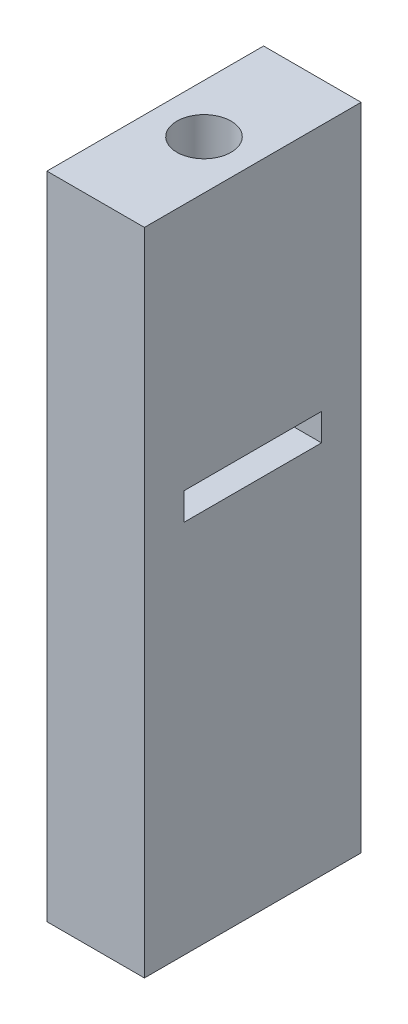
from build123d import *

# Parameters (mm, degrees)
SKETCH1_W           = 9
SKETCH1_H           = 20
BOSS_EXTRUDE1_DEPTH = 60
SKETCH2_R           = 2.5
CUT_EXTRUDE1_DEPTH  = 22
SKETCH3_W           = 12.7
SKETCH3_H           = 2.52
CUT_EXTRUDE2_DEPTH  = 5


with BuildPart() as part:
    # Sketch1 → Boss-Extrude1 (new body)
    with BuildSketch(Plane(origin=(0, 0, 0), x_dir=(1, 0, 0), z_dir=(0, 1, 0))):
        with Locations((28.172124636, -38.360472269)):
            Rectangle(SKETCH1_W, SKETCH1_H)
    extrude(amount=BOSS_EXTRUDE1_DEPTH)

    # Sketch2 → Cut-Extrude1 (cut)
    with BuildSketch(Plane(origin=(0, 60, 0), x_dir=(1, 0, 0), z_dir=(0, 1, 0))):
        with Locations((28.172124636, -38.360472269)):
            Circle(SKETCH2_R)
    extrude(amount=-CUT_EXTRUDE1_DEPTH, mode=Mode.SUBTRACT)

    # Sketch3 → Cut-Extrude2 (cut)
    with BuildSketch(Plane(origin=(32.672124636, 0, 0), x_dir=(0, 0, -1), z_dir=(1, 0, 0))):
        with Locations((-38.360472269, 35.86)):
            Rectangle(SKETCH3_W, SKETCH3_H)
    extrude(amount=-CUT_EXTRUDE2_DEPTH, mode=Mode.SUBTRACT)


solid = part.part
